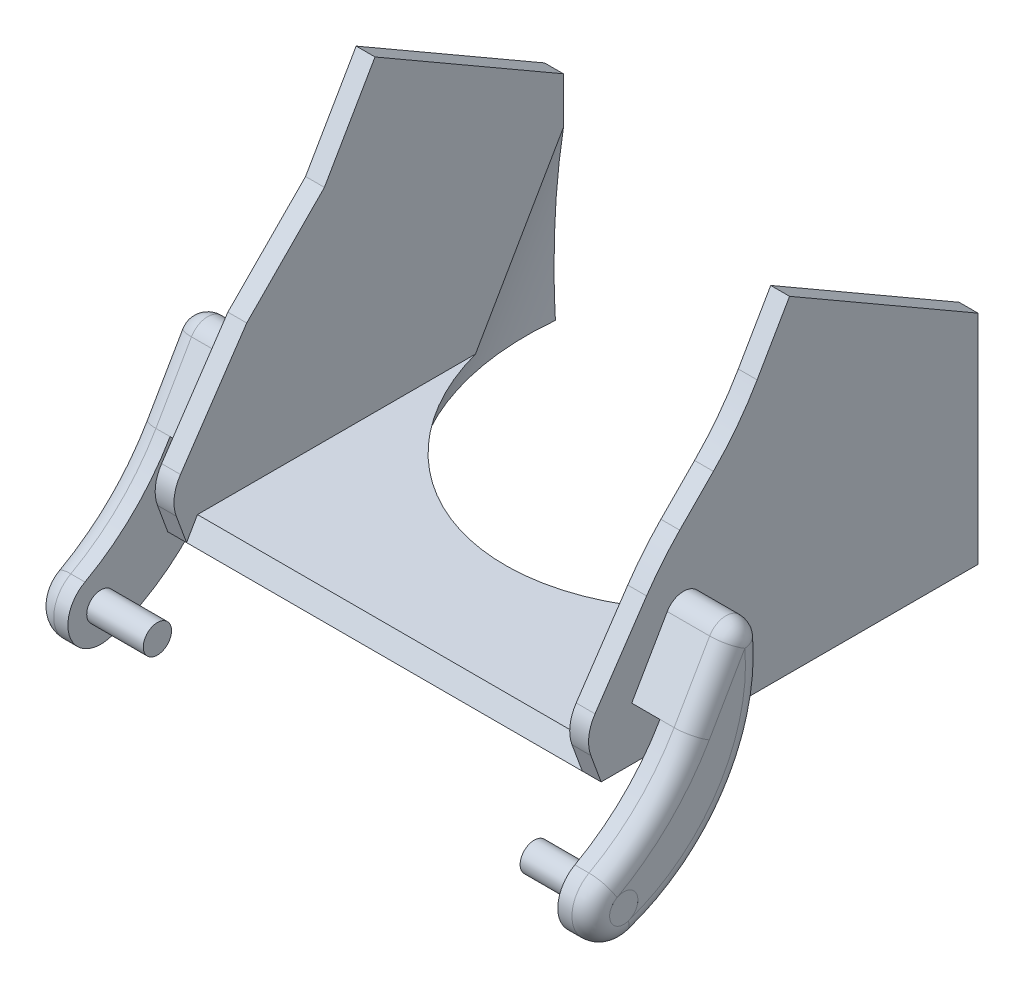
from build123d import *

# Parameters (mm, degrees)
SKETCH1_W                = 46
SKETCH1_H                = 40
BOSS_EXTRUDE1_DEPTH      = 40
SHELL1_T                 = -2
CUT_EXTRUDE1_DEPTH       = 62.065538563
CUT_EXTRUDE1_DEPTH_BACK  = 62.065538563
SKETCH2_R                = 22
SKETCH5_R                = 1.5
BOSS_EXTRUDE2_DEPTH      = 6.5
BOSS_EXTRUDE4_DEPTH      = 2
SKETCH6_W                = 3
SKETCH6_H                = 14
FILLET1_R                = 30
FILLET2_R                = 2
BOSS_EXTRUDE5_DEPTH      = 3.5
BOSS_EXTRUDE5_DEPTH_BACK = 6
BOSS_EXTRUDE5_START      = 3
SKETCH5_4_R              = 1.5
FILLET2_OF_MIRROR2_R     = 2


with BuildPart() as part:
    # Sketch1 → Boss-Extrude1 (new body)
    with BuildSketch(Plane.XY):
        with Locations((0, 20)):
            Rectangle(SKETCH1_W, SKETCH1_H)
    extrude(amount=BOSS_EXTRUDE1_DEPTH)

    # Shell1
    shell1_openings = [part.faces().sort_by_distance(p)[0] for p in [
        (0, 20, 40),
        (0, 20, 0),
        (0, 40, 20),
    ]]
    offset(amount=SHELL1_T, openings=shell1_openings, kind=Kind.INTERSECTION)

    # Sketch2 → Cut-Extrude1 (cut, two sides: drawn at the far end of the back side and taken through both)
    with BuildSketch(Plane(origin=(0, 0, 0), x_dir=(1, 0, 0), z_dir=(0, 0.866025403784438, -0.5000000000000009)).offset(-CUT_EXTRUDE1_DEPTH_BACK)):
        with Locations((0, -2.529345721)):
            Circle(SKETCH2_R)
    extrude(amount=CUT_EXTRUDE1_DEPTH + CUT_EXTRUDE1_DEPTH_BACK, mode=Mode.SUBTRACT)

    # SurfaceCut1
    split(bisect_by=Plane(origin=(0, 17.320508076, 30), x_dir=(1, 0, 0), z_dir=(0, 0.500000000000001, 0.8660254037844382)), keep=Keep.BOTTOM)

    # SurfaceCut3
    split(bisect_by=Plane(origin=(0, 17.320508076, -10), x_dir=(1, 0, 0), z_dir=(0, 0.8660254037844383, -0.5000000000000009)), keep=Keep.BOTTOM)

    # Sketch5 → Boss-Extrude2 (add)
    with BuildSketch(Plane(origin=(23, 0, 0), x_dir=(0, 0, -1), z_dir=(1, 0, 0))):
        with BuildLine():
            Line((-30.428606571, 16.578139719), (-36.752885286, 5.624167662))
            ThreePointArc((-36.752885286, 5.624167662), (-40.664109848, 0.580005541), (-45.78638337, -3.228348836))
            ThreePointArc((-45.78638337, -3.228348836), (-47.30285007, -7.701148858), (-42.983852284, -9.61213536))
            ThreePointArc((-42.983852284, -9.61213536), (-31.17133355, 0.829651746), (-30.428606571, 16.578139719))
        make_face()
        with Locations(Location((-44.098076211, -6.294228634, 0), (0, 0, 270))):
            Circle(SKETCH5_R, mode=Mode.SUBTRACT)
    boss_extrude2 = extrude(amount=BOSS_EXTRUDE2_DEPTH)

    # Sketch7 → Boss-Extrude4 (add)
    with BuildSketch(Plane(origin=(23, 0, 0), x_dir=(0, 0, -1), z_dir=(1, 0, 0))):
        with BuildLine():
            Line((-40, 0), (-41.089735051, 2.969217608))
            ThreePointArc((-41.089735051, 2.969217608), (-41.305273506, 4.831245785), (-40.648861101, 6.587015847))
            Line((-40.648861101, 6.587015847), (-33.615164299, 16.99545983))
            Line((-33.615164299, 16.99545983), (-25.370739685, 25.338622143))
            Line((-25.370739685, 25.338622143), (-40, 0))
        make_face()
    boss_extrude4 = extrude(amount=-BOSS_EXTRUDE4_DEPTH)

    # Sketch6 → Cut-Revolve1 (revolve, cut)
    with BuildSketch(Plane(origin=(0, -27.5, 7.368602792), x_dir=(1, 0, 0), z_dir=(0, 0.8660254037844382, -0.500000000000001)), mode=Mode.PRIVATE) as cut_revolve1_sk:
        with Locations((24.5, -35.411542732)):
            Rectangle(SKETCH6_W, SKETCH6_H)
    cut_revolve1 = revolve(cut_revolve1_sk.sketch.rotate(Axis((23, -6.294228634, 44.098076211), (1, 0, 0)), 300), axis=Axis((23, -6.294228634, 44.098076211), (1, 0, 0)), mode=Mode.SUBTRACT)

    # Fillet1
    fillet1_edges = [part.edges().sort_by_distance(p)[0] for p in [
        (22, 25.338622143, 25.370739685),
        (22, 16.99545983, 33.615164299),
    ]]
    fillet(fillet1_edges, radius=FILLET1_R)

    # Fillet2
    fillet2_edges = [part.edges().sort_by_distance(p)[0] for p in [
        (26.25, 16.578139719, 30.428606571),
        (29.5, 0.580005541, 40.664109848),
        (29.5, 0.829651746, 31.17133355),
        (29.5, 11.101153691, 33.590745928),
        (29.5, -7.701148858, 47.30285007),
    ]]
    fillet(fillet2_edges, radius=FILLET2_R - 0.0001)  # a hair under: the kernel refuses the full size

    # Mirror2: Boss-Extrude2, Boss-Extrude4, Cut-Revolve1 across plane
    add(boss_extrude2.mirror(Plane(origin=(0, 0, 0), x_dir=(0, 0, 1), z_dir=(1, 0, 0))))
    add(boss_extrude4.mirror(Plane(origin=(0, 0, 0), x_dir=(0, 0, 1), z_dir=(1, 0, 0))))
    add(cut_revolve1.mirror(Plane(origin=(0, 0, 0), x_dir=(0, 0, 1), z_dir=(1, 0, 0))), mode=Mode.SUBTRACT)

    # Fillet2 of Mirror2
    fillet2_of_mirror2_edges = [part.edges().sort_by_distance(p)[0] for p in [
        (-26.25, 16.578139719, 30.428606571),
        (-29.5, 0.580005541, 40.664109848),
        (-29.5, 0.829651746, 31.17133355),
        (-29.5, 11.101153691, 33.590745928),
        (-29.5, -7.701148858, 47.30285007),
    ]]
    fillet(fillet2_of_mirror2_edges, radius=FILLET2_OF_MIRROR2_R - 0.0001)  # a hair under: the kernel refuses the full size


with BuildPart() as body_2:
    # Sketch5<4> → Boss-Extrude5 (new, two sides: drawn at the far end of the back side and taken through both)
    with BuildSketch(Plane(origin=(23, 0, 0), x_dir=(0, 0, -1), z_dir=(1, 0, 0)).offset(BOSS_EXTRUDE5_START - BOSS_EXTRUDE5_DEPTH_BACK)):
        with Locations(Location((-44.098076211, -6.294228634, 0), (0, 0, 90))):
            Circle(SKETCH5_4_R)
    extrude(amount=BOSS_EXTRUDE5_DEPTH + BOSS_EXTRUDE5_DEPTH_BACK)


with BuildPart() as body_3:
    # Mirror4: mirrored copy
    add(body_2.part.mirror(Plane(origin=(0, 0, 0), x_dir=(0, 0, 1), z_dir=(1, 0, 0))))


solid = Compound([part.part, body_2.part, body_3.part])
